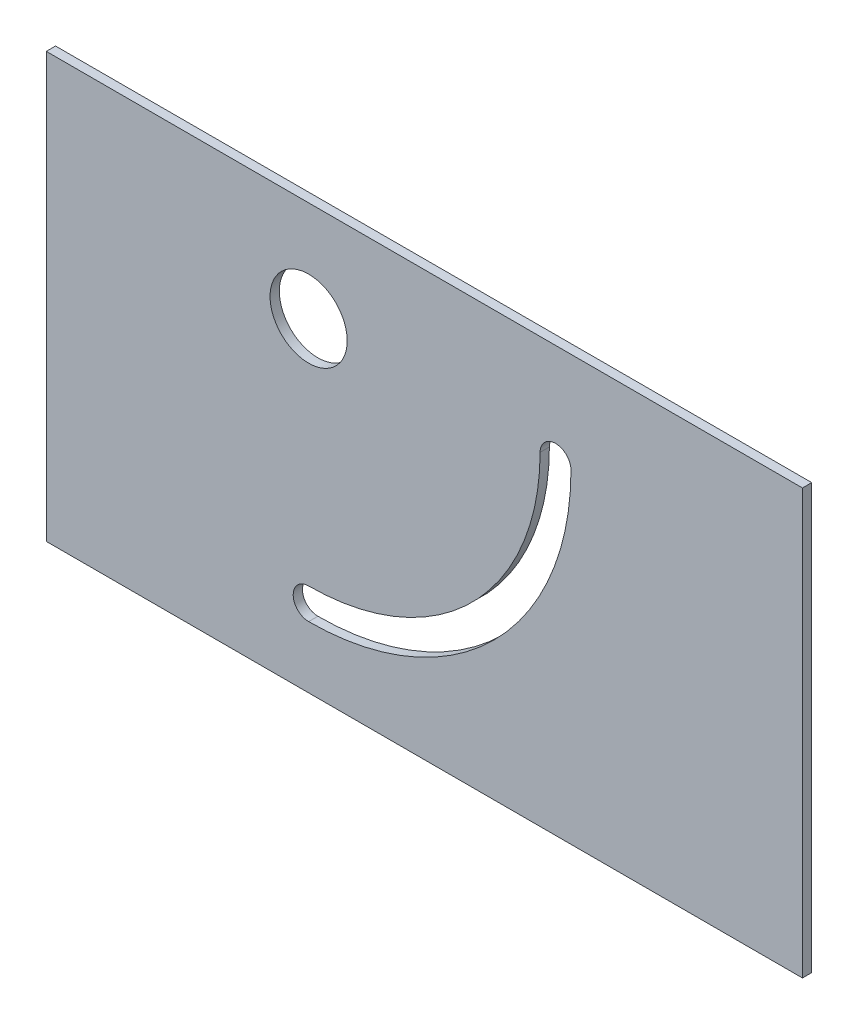
from build123d import *

# Parameters (mm, degrees)
SKETCH1_W           = 245
SKETCH1_H           = 137.5
SKETCH1_R           = 12.5
BOSS_EXTRUDE1_DEPTH = 3


with BuildPart() as part:
    # Sketch1 → Boss-Extrude1 (new body)
    with BuildSketch(Plane.XY):
        with Locations((122, 68.75)):
            Rectangle(SKETCH1_W, SKETCH1_H)
        with Locations((84.5, 105)):
            Circle(SKETCH1_R, mode=Mode.SUBTRACT)
        with BuildLine():
            ThreePointArc((169.5, 105), (164.5, 110), (159.5, 105))
            ThreePointArc((159.5, 105), (137.533008589, 51.966991411), (84.5, 30))
            ThreePointArc((84.5, 30), (79.5, 25), (84.5, 20))
            ThreePointArc((84.5, 20), (144.604076401, 44.895923599), (169.5, 105))
        make_face(mode=Mode.SUBTRACT)
    extrude(amount=BOSS_EXTRUDE1_DEPTH)


solid = part.part
